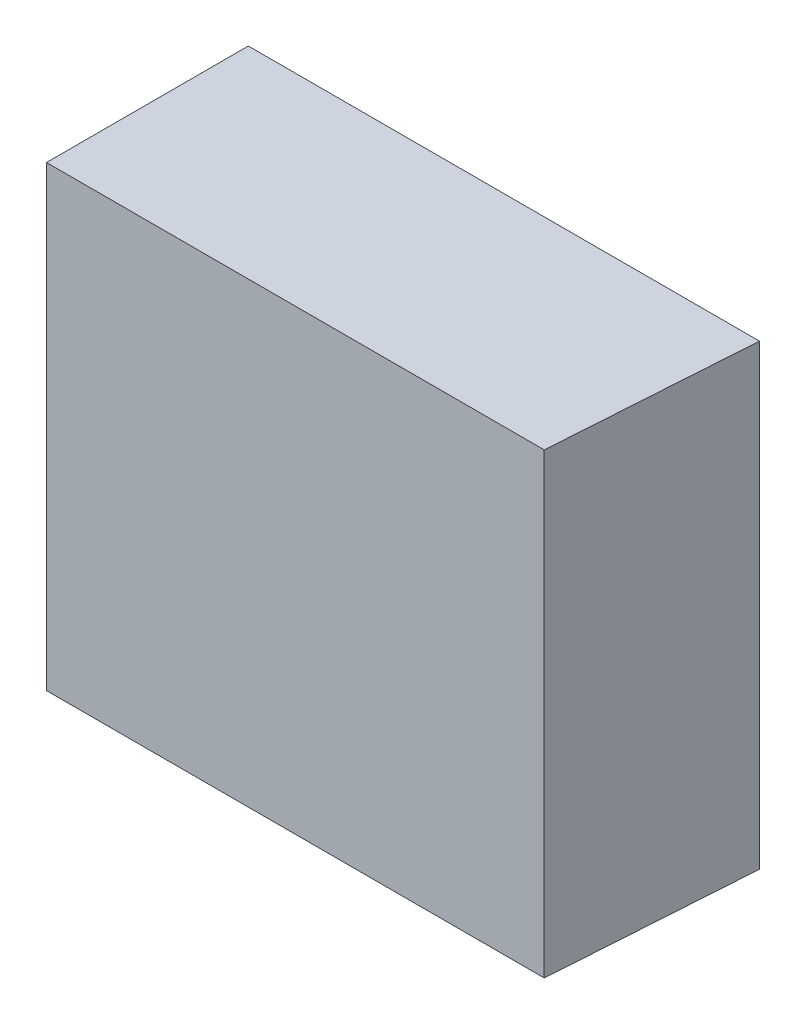
from build123d import *

# Parameters (mm, degrees)
EXTRUDE_2_DEPTH = 170
SHELL_2_T       = -4


with BuildPart() as part:
    # 草图1 → 凸台-拉伸2 (new, symmetric)
    with BuildSketch(Plane(origin=(0, 0, 0), x_dir=(1, 0, 0), z_dir=(0, 1, 0))):
        Polygon((230, 0), (0, 0), (-150, 0), (-150, -150), (220, -150), align=None)
    extrude(amount=EXTRUDE_2_DEPTH, both=True)

    # 抽壳2
    shell_2_openings = [part.faces().sort_by_distance(p)[0] for p in [
        (40, 0, 0),
    ]]
    offset(amount=SHELL_2_T, openings=shell_2_openings, kind=Kind.INTERSECTION)


solid = part.part
